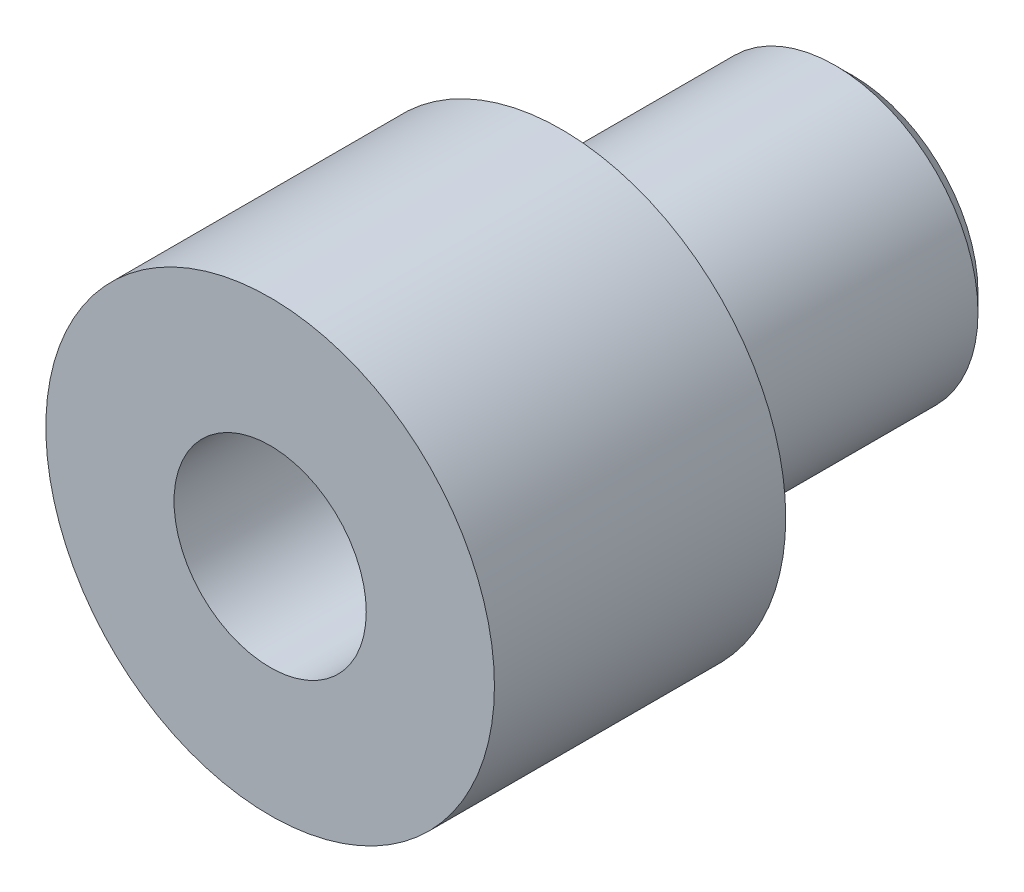
from build123d import *

# Parameters (mm, degrees)
CHAMFER1_SIZE = 0.3


with BuildPart() as part:
    # Sketch1 → Revolve1 (revolve)
    with BuildSketch(Plane(origin=(0, 0, 0), x_dir=(0, 0, -1), z_dir=(1, 0, 0))):
        Polygon((0, 1.65), (0, 3.85), (5, 3.85), (5, 2.45), (10, 2.45), (10, 1.65), align=None)
    revolve(axis=Axis((0, 0, 0), (0, 0, -1)))

    # Chamfer1
    chamfer1_edges = [part.edges().sort_by_distance(p)[0] for p in [
        (0, -2.45, -10),
    ]]
    chamfer(chamfer1_edges, length=CHAMFER1_SIZE)


solid = part.part
